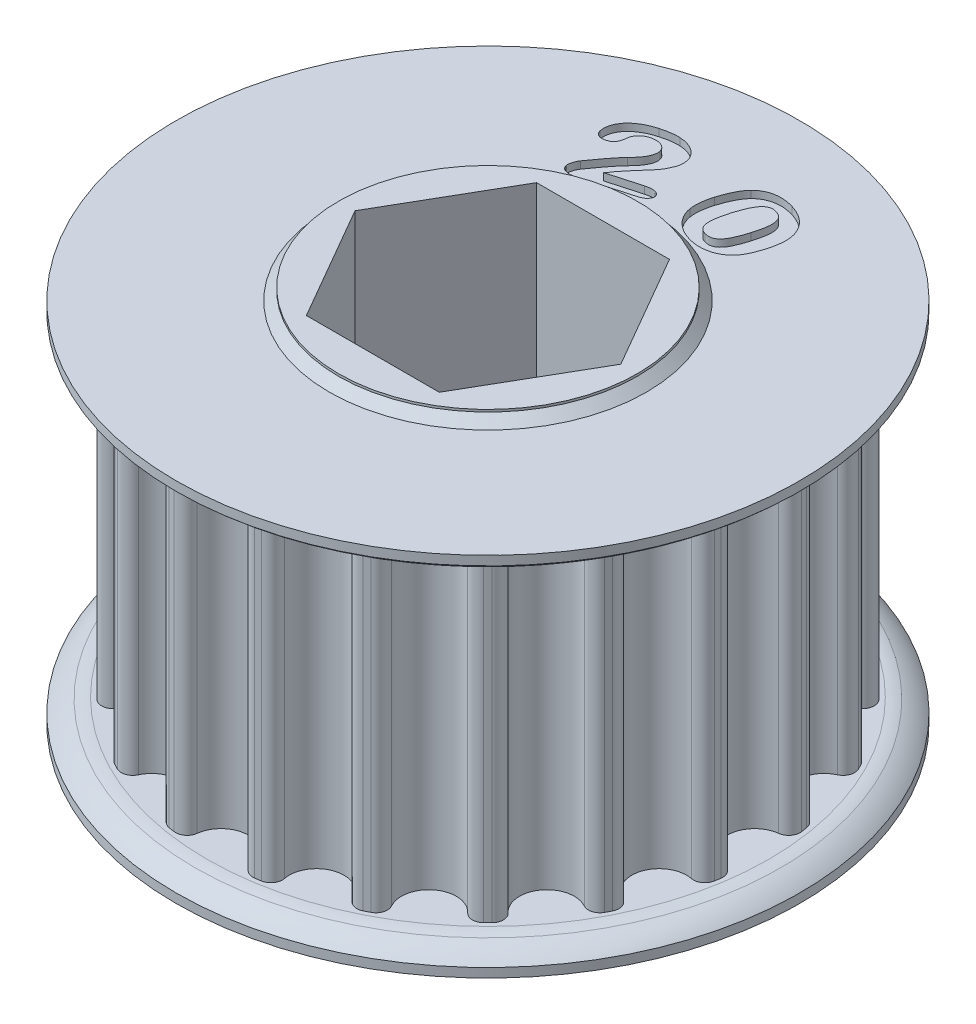
from build123d import *

# Parameters (mm, degrees)
SKETCH1_R               = 15.34399401
TOOTHOD_DEPTH           = 8.89
TOOTHPROFILE_DEPTH      = 29.053604124
TOOTHPATTERN_COUNT      = 20
SKETCH6_W               = 8.2931
SKETCH6_H               = 0.635
BORE_DEPTH              = 27.757745097
BORE_DEPTH_BACK         = 27.757745097
LARGE_TOOTH_COUNT_DEPTH = 0.4
CHAMFER1_SIZE           = 0.508


with BuildPart() as part:
    # Sketch1 → ToothOD (new, symmetric)
    with BuildSketch(Plane(origin=(0, 0, 0), x_dir=(1, 0, 0), z_dir=(0, 1, 0))):
        Circle(SKETCH1_R)
    extrude(amount=TOOTHOD_DEPTH, both=True)

    # Sketch2 → ToothProfile (cut, through all)
    with BuildSketch(Plane(origin=(0, 8.89, 0), x_dir=(1, 0, 0), z_dir=(0, 1, 0))):
        with BuildLine():
            ThreePointArc((-1.514151189, 14.627414336), (0, 13.28399401), (1.514151189, 14.627414336))
            ThreePointArc((1.514151189, 14.627414336), (1.759047929, 15.056333772), (2.237219512, 15.180019797))
            ThreePointArc((2.237219512, 15.180019797), (0, 15.34399401), (-2.237219512, 15.180019797))
            ThreePointArc((-2.237219512, 15.180019797), (-1.759047929, 15.056333772), (-1.514151189, 14.627414336))
        make_face()
    toothprofile = extrude(amount=-TOOTHPROFILE_DEPTH, mode=Mode.SUBTRACT)

    # ToothPattern: ToothProfile ×20 about axis
    toothpattern_axis = Axis((0, 8.89, 0), (0, -1, 0))
    for i in range(1, TOOTHPATTERN_COUNT):
        add(toothprofile.rotate(toothpattern_axis, i * 360 / TOOTHPATTERN_COUNT), mode=Mode.SUBTRACT)

    # Sketch4 → Flange (revolve)
    with BuildSketch(Plane.XY):
        with BuildLine():
            Line((0, -8.89), (15.59799401, -8.89))
            ThreePointArc((15.59799401, -8.89), (15.92375, -8.915622571), (16.243566338, -8.982637424))
            ThreePointArc((16.243566338, -8.982637424), (16.811294915, -9.264197125), (17.31249401, -9.652))
            Line((17.31249401, -9.652), (17.31249401, -10.16))
            Line((17.31249401, -10.16), (0, -10.16))
            Line((0, -10.16), (0, -8.89))
        make_face()
        with BuildLine():
            Line((17.31249401, 10.16), (17.31249401, 9.652))
            ThreePointArc((17.31249401, 9.652), (16.811294915, 9.264197125), (16.243566338, 8.982637424))
            ThreePointArc((16.243566338, 8.982637424), (15.92375, 8.915622571), (15.59799401, 8.89))
            Line((15.59799401, 8.89), (0, 8.89))
            Line((0, 8.89), (0, 10.16))
            Line((0, 10.16), (17.31249401, 10.16))
        make_face()
    revolve(axis=Axis((0, 12.09802, 0), (0, -1, 0)))

    # Sketch6 → TopBearingBoss (revolve)
    with BuildSketch(Plane.XY):
        with Locations((4.14655, 10.4775)):
            Rectangle(SKETCH6_W, SKETCH6_H)
    revolve(axis=Axis((0, 12.09802, 0), (0, -1, 0)))

    # Sketch7 → Bore (cut, two sides: drawn at the far end of the back side and taken through both)
    with BuildSketch(Plane.XZ.offset(-BORE_DEPTH_BACK)):
        Polygon((3.688171255, 6.3881), (-3.688171255, 6.3881), (-7.376342509, 0), (-3.688171255, -6.3881), (3.688171255, -6.3881), (7.376342509, 0), align=None)
    extrude(amount=BORE_DEPTH + BORE_DEPTH_BACK, mode=Mode.SUBTRACT)

    # Sketch9 → Large Tooth Count (cut)
    # profile 1 of 2: a face of its own
    with BuildSketch(Plane(origin=(0, 10.16, 0), x_dir=(1, 0, 0), z_dir=(0, 1, 0))):
        with BuildLine():
            Line((-2.954146893, 9.361462675), (-1.175353143, 9.862418144))
            add(Edge.make_bspline(
                [(-1.175353143, 9.862418144), (-1.123805554, 9.875802418), (-1.026048459, 9.901184938), (-0.883304523, 9.919166454), (-0.754108312, 9.920384436), (-0.63935479, 9.903206029), (-0.541555305, 9.870084112), (-0.462297286, 9.823371078), (-0.402653568, 9.761037925), (-0.383751751, 9.709454292), (-0.374360174, 9.683824394)],
                knots=[0, 0, 0, 0, 1.416600478, 2.686502891, 3.819686855, 4.846312523, 5.7610532, 6.550671378, 7.279885059, 8, 8, 8, 8], degree=3))
            add(Edge.make_bspline(
                [(-0.374360174, 9.683824394), (-0.369719108, 9.660087819), (-0.360266106, 9.611740771), (-0.371972129, 9.535402151), (-0.403229262, 9.458544917), (-0.453267189, 9.380882786), (-0.526096867, 9.307089619), (-0.62160342, 9.241903313), (-0.739824812, 9.186663473), (-0.827592685, 9.159151), (-0.874422674, 9.144471269)],
                knots=[0, 0, 0, 0, 0.710365878, 1.446884956, 2.24079361, 3.150954831, 4.15871712, 5.283676882, 6.550661213, 8, 8, 8, 8], degree=3))
            Line((-0.874422674, 9.144471269), (-3.564937518, 8.387233769))
            add(Edge.make_bspline(
                [(-3.564937518, 8.387233769), (-3.61171521, 8.37543609), (-3.700837127, 8.352958886), (-3.832442975, 8.342282282), (-3.953746135, 8.349940914), (-4.062486177, 8.379695319), (-4.157127763, 8.424314562), (-4.233382296, 8.48426447), (-4.291165156, 8.557997927), (-4.311755017, 8.615372811), (-4.322175018, 8.644408769)],
                knots=[0, 0, 0, 0, 1.301754116, 2.480131396, 3.552996869, 4.569626462, 5.508600737, 6.361601131, 7.170848347, 8, 8, 8, 8], degree=3))
            add(Edge.make_bspline(
                [(-4.322175018, 8.644408769), (-4.326580812, 8.665164293), (-4.336073853, 8.709885638), (-4.332624611, 8.784411615), (-4.322455052, 8.869128107), (-4.299543845, 8.961161902), (-4.27034487, 9.054523865), (-4.235617728, 9.143365747), (-4.1961476, 9.224365129), (-4.163762464, 9.272780303), (-4.148046112, 9.296275956)],
                knots=[0, 0, 0, 0, 0.735191842, 1.58409722, 2.57532651, 3.702715511, 4.874795235, 5.976270416, 7.017893645, 8, 8, 8, 8], degree=3))
            add(Edge.make_bspline(
                [(-4.148046112, 9.296275956), (-4.087211058, 9.382429832), (-3.969092279, 9.549708234), (-3.794337723, 9.790740454), (-3.627134069, 10.014150132), (-3.493100044, 10.188605296), (-3.391151145, 10.317214682), (-3.321382624, 10.403735091), (-3.257675155, 10.482773388), (-3.197071967, 10.55186435), (-3.144281079, 10.614722485), (-3.095438484, 10.668632161), (-3.052483765, 10.714698958), (-3.024770261, 10.742069301), (-3.012189862, 10.754493925)],
                knots=[0, 0, 0, 0, 2.052272746, 3.984741291, 5.793026345, 7.482136723, 8.265501849, 8.986445627, 9.645011633, 10.240581551, 10.774583818, 11.242129634, 11.655968724, 12, 12, 12, 12], degree=3))
            add(Edge.make_bspline(
                [(-3.012189862, 10.754493925), (-2.97279762, 10.794299168), (-2.896763622, 10.871130331), (-2.792806568, 10.988869332), (-2.701039663, 11.102694717), (-2.620574498, 11.212717556), (-2.553383732, 11.320286413), (-2.497592916, 11.424476859), (-2.454002898, 11.526306534), (-2.422746917, 11.625053273), (-2.402709489, 11.71988848), (-2.394004008, 11.810101015), (-2.397937406, 11.895345873), (-2.409888983, 11.949103964), (-2.415686737, 11.975182206)],
                knots=[0, 0, 0, 0, 1.423552018, 2.747707314, 3.991028065, 5.139956742, 6.210844286, 7.212885815, 8.141975106, 9.022746377, 9.842005735, 10.601823445, 11.321739559, 12, 12, 12, 12], degree=3))
            add(Edge.make_bspline(
                [(-2.415686737, 11.975182206), (-2.42429087, 12.001758675), (-2.441249197, 12.0541396), (-2.482578582, 12.125664714), (-2.535327991, 12.18909487), (-2.598872825, 12.244238856), (-2.671873029, 12.2906639), (-2.752660218, 12.328719573), (-2.842148698, 12.355153399), (-2.938047159, 12.37159083), (-3.038305704, 12.378979246), (-3.141121707, 12.374657925), (-3.245814936, 12.36229657), (-3.314774119, 12.344214881), (-3.349732049, 12.335048613)],
                knots=[0, 0, 0, 0, 0.90254133, 1.778864972, 2.655082592, 3.563625712, 4.491394034, 5.448683676, 6.445761391, 7.502723384, 8.594618504, 9.694102356, 10.831056182, 12, 12, 12, 12], degree=3))
            add(Edge.make_bspline(
                [(-3.349732049, 12.335048613), (-3.382418939, 12.324700344), (-3.446620887, 12.304374794), (-3.537125411, 12.263067652), (-3.620087769, 12.213267396), (-3.696565155, 12.156329349), (-3.765107736, 12.089722279), (-3.824340499, 12.013694183), (-3.879435722, 11.931578737), (-3.907718253, 11.87113381), (-3.922125018, 11.840343925)],
                knots=[0, 0, 0, 0, 1.049930399, 2.062220621, 3.039893766, 4.010392484, 4.977929152, 5.957982101, 6.959821796, 8, 8, 8, 8], degree=3))
            add(Edge.make_bspline(
                [(-3.922125018, 11.840343925), (-3.924346544, 11.832933466), (-3.931168204, 11.810178107), (-3.937056605, 11.762522536), (-3.950091222, 11.690823835), (-3.961933852, 11.598900745), (-3.979992527, 11.497578612), (-4.007626887, 11.398655278), (-4.042740729, 11.30637416), (-4.085519388, 11.220216479), (-4.144929258, 11.141703059), (-4.227777014, 11.077150199), (-4.330942518, 11.022005189), (-4.409730011, 10.997774061), (-4.451655487, 10.984879863)],
                knots=[0, 0, 0, 0, 0.255495149, 0.784551133, 1.582182714, 2.666380175, 3.847664823, 4.981851255, 6.056538028, 7.108499466, 8.153764709, 9.280368537, 10.552792622, 12, 12, 12, 12], degree=3))
            add(Edge.make_bspline(
                [(-4.451655487, 10.984879863), (-4.484518593, 10.977014405), (-4.548160913, 10.961782248), (-4.644496368, 10.956258535), (-4.73670461, 10.966954595), (-4.82346759, 10.993238394), (-4.901057808, 11.035922061), (-4.965744414, 11.095093645), (-5.016154224, 11.169717324), (-5.035502925, 11.227460955), (-5.045479705, 11.257235331)],
                knots=[0, 0, 0, 0, 1.104655038, 2.139262494, 3.14009217, 4.129518318, 5.089274639, 6.013546725, 6.975724119, 8, 8, 8, 8], degree=3))
            add(Edge.make_bspline(
                [(-5.045479705, 11.257235331), (-5.05397104, 11.293084372), (-5.071349422, 11.366453082), (-5.077754738, 11.481958813), (-5.072725552, 11.603249079), (-5.051844202, 11.729081667), (-5.016292017, 11.857336166), (-4.964770167, 11.985211731), (-4.897422878, 12.111016582), (-4.814660026, 12.23509846), (-4.715205717, 12.356092866), (-4.597286749, 12.47195975), (-4.46284857, 12.584034957), (-4.31031455, 12.689978389), (-4.14049305, 12.79094259), (-3.950695814, 12.87981994), (-3.743341884, 12.961365981), (-3.596866185, 13.004705712), (-3.521182049, 13.027099394)],
                knots=[0, 0, 0, 0, 0.684205447, 1.400296104, 2.14308195, 2.939673375, 3.767285031, 4.614614734, 5.499007285, 6.417452817, 7.385287256, 8.407291256, 9.488547988, 10.637669497, 11.859015001, 13.159415024, 14.532266988, 16, 16, 16, 16], degree=3))
            add(Edge.make_bspline(
                [(-3.521182049, 13.027099394), (-3.4736299, 13.03988753), (-3.380335158, 13.064977161), (-3.241544955, 13.097089226), (-3.107026771, 13.124112364), (-2.976265984, 13.14490228), (-2.8495897, 13.158917372), (-2.727192142, 13.168269746), (-2.608850533, 13.171070654), (-2.531470246, 13.16854091), (-2.493375018, 13.167295488)],
                knots=[0, 0, 0, 0, 1.134348345, 2.225530054, 3.281228752, 4.294749574, 5.274655805, 6.216612838, 7.122017479, 8, 8, 8, 8], degree=3))
            add(Edge.make_bspline(
                [(-2.493375018, 13.167295488), (-2.439709954, 13.16272022), (-2.334541326, 13.153753966), (-2.181332224, 13.127305431), (-2.036981563, 13.087440761), (-1.901006644, 13.037993111), (-1.775042238, 12.977076771), (-1.658865503, 12.907098719), (-1.552797444, 12.827923999), (-1.459758972, 12.738048259), (-1.376703421, 12.643511102), (-1.309975797, 12.541360057), (-1.254518112, 12.43604159), (-1.230849347, 12.361372234), (-1.219108612, 12.324332988)],
                knots=[0, 0, 0, 0, 1.190830805, 2.333697818, 3.432410255, 4.498757827, 5.529248872, 6.521607877, 7.494563189, 8.449082834, 9.378017597, 10.270819197, 11.142251172, 12, 12, 12, 12], degree=3))
            add(Edge.make_bspline(
                [(-1.219108612, 12.324332988), (-1.211383801, 12.294688493), (-1.195989155, 12.235610479), (-1.183332882, 12.145192252), (-1.176603551, 12.054774787), (-1.178486449, 11.963899215), (-1.188610174, 11.872881101), (-1.205430531, 11.781423706), (-1.230525716, 11.690002431), (-1.274849659, 11.570781829), (-1.33741533, 11.429640428), (-1.41591175, 11.271086939), (-1.50151055, 11.130952631), (-1.579521706, 11.024672795), (-1.647287016, 10.941396881), (-1.706925628, 10.872235184), (-1.772228142, 10.792201909), (-1.847731998, 10.704799598), (-1.931711291, 10.608913676), (-2.022333861, 10.502919779), (-2.123153923, 10.389883416), (-2.227945717, 10.269423426), (-2.334199707, 10.149850826), (-2.432223405, 10.033064938), (-2.522427016, 9.924904713), (-2.603216232, 9.823238211), (-2.675411176, 9.729477266), (-2.73794607, 9.642126083), (-2.79312732, 9.563443557), (-2.824329241, 9.511648282), (-2.838953924, 9.487371269)],
                knots=[0, 0, 0, 0, 0.759348993, 1.513293812, 2.260847921, 3.006759253, 3.764275153, 4.530379131, 5.311389733, 6.112558984, 7.683247224, 9.139506665, 10.498308862, 11.750708933, 12.406871982, 13.161322828, 14.015965315, 14.96902083, 16.02622199, 17.177907503, 18.428216246, 19.783402464, 21.138588682, 22.396006758, 23.565473171, 24.632146706, 25.617187237, 26.500440687, 27.297140101, 28, 28, 28, 28], degree=3))
            add(Edge.make_bspline(
                [(-2.838953924, 9.487371269), (-2.855289837, 9.463900755), (-2.888073876, 9.416798504), (-2.932072354, 9.379949994), (-2.954146893, 9.361462675)],
                knots=[0, 0, 0, 0, 0.996577163, 2, 2, 2, 2], degree=3))
        make_face()
    # profile 2 of 2: a face of its own
    with BuildSketch(Plane(origin=(0, 10.16, 0), x_dir=(1, 0, 0), z_dir=(0, 1, 0))):
        with BuildLine():
            add(Edge.make_bspline(
                [(5.214409045, 10.150130338), (5.190714867, 10.074880459), (5.1449507, 9.929538937), (5.067123561, 9.722992573), (4.985074358, 9.534662094), (4.897683151, 9.362490125), (4.797990216, 9.204699763), (4.68207819, 9.059315083), (4.548391417, 8.924355594), (4.448207144, 8.844811647), (4.397342639, 8.804426432)],
                knots=[0, 0, 0, 0, 1.18011728, 2.279339777, 3.300312696, 4.252335004, 5.165279864, 6.087474786, 7.028992811, 8, 8, 8, 8], degree=3))
            add(Edge.make_bspline(
                [(4.397342639, 8.804426432), (4.368452389, 8.783759012), (4.310444351, 8.742261398), (4.218090567, 8.68760354), (4.122567032, 8.636381907), (4.021053968, 8.594804769), (3.917071626, 8.55542857), (3.807864453, 8.524522636), (3.694856927, 8.498897601), (3.578149786, 8.477916033), (3.458784674, 8.465052918), (3.337809148, 8.457659325), (3.215789514, 8.457269131), (3.092816601, 8.466425015), (2.968336345, 8.478893397), (2.842901635, 8.500737733), (2.716334551, 8.529457806), (2.632441476, 8.553128463), (2.589973889, 8.565110807)],
                knots=[0, 0, 0, 0, 0.901536881, 1.810174201, 2.722951407, 3.650873295, 4.592999596, 5.545017892, 6.529601249, 7.5348545, 8.553963068, 9.576094043, 10.611551205, 11.649240286, 12.705913058, 13.786930103, 14.879719961, 16, 16, 16, 16], degree=3))
            add(Edge.make_bspline(
                [(2.589973889, 8.565110807), (2.543632445, 8.579700214), (2.452042396, 8.608534977), (2.319678008, 8.661606647), (2.193694452, 8.721556974), (2.07328836, 8.787716416), (1.959122861, 8.861323411), (1.84975651, 8.940228266), (1.747631416, 9.027720056), (1.651608943, 9.121077228), (1.562444683, 9.219388851), (1.482907007, 9.322900319), (1.410803045, 9.429205404), (1.348352462, 9.54012966), (1.294619283, 9.655154495), (1.248761777, 9.773672505), (1.213020235, 9.896616587), (1.195786369, 9.980335913), (1.187119983, 10.022435807)],
                knots=[0, 0, 0, 0, 1.093974974, 2.162151445, 3.208754958, 4.235018977, 5.254163096, 6.266603484, 7.270125483, 8.279987647, 9.281626696, 10.256545703, 11.217884655, 12.172537706, 13.120291723, 14.075274297, 15.032114198, 16, 16, 16, 16], degree=3))
            add(Edge.make_bspline(
                [(1.187119983, 10.022435807), (1.180867164, 10.069996862), (1.168240345, 10.166040708), (1.1601745, 10.312869392), (1.163621366, 10.463459377), (1.174789304, 10.6179706), (1.197160825, 10.776345136), (1.22609065, 10.938288092), (1.264806684, 11.103647427), (1.296751927, 11.213792398), (1.313028577, 11.26991315)],
                knots=[0, 0, 0, 0, 0.910485463, 1.838616153, 2.788107085, 3.768457025, 4.77780678, 5.823027201, 6.890795017, 8, 8, 8, 8], degree=3))
            add(Edge.make_bspline(
                [(1.313028577, 11.26991315), (1.33538935, 11.341535758), (1.379078841, 11.481475247), (1.452154195, 11.682542865), (1.529127683, 11.87032368), (1.609998022, 12.044290335), (1.6952769, 12.205137541), (1.787378592, 12.350429447), (1.883615047, 12.482465752), (1.954403412, 12.561103972), (1.98900592, 12.599543619)],
                knots=[0, 0, 0, 0, 1.196779593, 2.338322093, 3.411423727, 4.433178792, 5.397622731, 6.313149774, 7.175440056, 8, 8, 8, 8], degree=3))
            add(Edge.make_bspline(
                [(1.98900592, 12.599543619), (2.018628391, 12.628603845), (2.077103584, 12.685969161), (2.171791495, 12.762895464), (2.270271079, 12.832357217), (2.373785475, 12.892330016), (2.480624357, 12.946184702), (2.592696711, 12.989493011), (2.708793143, 13.025239338), (2.829056329, 13.052964555), (2.952560802, 13.072627552), (3.079412612, 13.083143097), (3.208835866, 13.085694737), (3.341290865, 13.080548732), (3.476299628, 13.065774952), (3.61437117, 13.043471927), (3.75507657, 13.012338384), (3.848891552, 12.985499356), (3.89638717, 12.971911588)],
                knots=[0, 0, 0, 0, 0.971271056, 1.917303395, 2.853215794, 3.790451001, 4.716264034, 5.652098562, 6.6001573, 7.558841376, 8.539768638, 9.526129073, 10.537034007, 11.569480832, 12.627883147, 13.715356414, 14.843355738, 16, 16, 16, 16], degree=3))
            add(Edge.make_bspline(
                [(3.89638717, 12.971911588), (3.961047138, 12.951501287), (4.087573261, 12.911562568), (4.26784755, 12.835416509), (4.436188729, 12.750440953), (4.590932452, 12.653297499), (4.733128735, 12.548330058), (4.861794309, 12.434592971), (4.975915242, 12.311534463), (5.075655196, 12.180079229), (5.162485109, 12.042696768), (5.235003627, 11.900099386), (5.294184558, 11.753211843), (5.321379679, 11.651830378), (5.334959827, 11.601204557)],
                knots=[0, 0, 0, 0, 1.170483588, 2.290393202, 3.375582303, 4.424020791, 5.441917151, 6.425119279, 7.385477153, 8.335528901, 9.2711732, 10.18851884, 11.095419263, 12, 12, 12, 12], degree=3))
            add(Edge.make_bspline(
                [(5.334959827, 11.601204557), (5.345438057, 11.551051125), (5.366875769, 11.448440786), (5.381402987, 11.288093713), (5.386496657, 11.119523422), (5.37668279, 10.94229087), (5.355085027, 10.756243659), (5.320633311, 10.561374709), (5.274470628, 10.357721475), (5.234765054, 10.220486907), (5.214409045, 10.150130338)],
                knots=[0, 0, 0, 0, 0.834578345, 1.707487665, 2.620008346, 3.581952147, 4.597888727, 5.671599988, 6.806290297, 8, 8, 8, 8], degree=3))
        make_face()
        with BuildLine():
            add(Edge.make_bspline(
                [(4.031225452, 10.56982565), (4.04357031, 10.611754452), (4.067764283, 10.693928279), (4.100757692, 10.814739321), (4.129381589, 10.930615781), (4.154607751, 11.040966004), (4.17517115, 11.146384723), (4.191469661, 11.246428339), (4.20286392, 11.341205651), (4.213841097, 11.457443534), (4.216752136, 11.592054856), (4.202110036, 11.740591906), (4.171074433, 11.872605872), (4.127424694, 11.969388232), (4.083881673, 12.037912926), (4.045434796, 12.084373108), (4.000776302, 12.126406709), (3.951930174, 12.1663729), (3.895704752, 12.200546592), (3.835309816, 12.2331379), (3.768732382, 12.260690902), (3.722073138, 12.275724197), (3.698148108, 12.283432682)],
                knots=[0, 0, 0, 0, 1.326170746, 2.599085169, 3.799445801, 4.94753492, 6.033295135, 7.057791564, 8.022292309, 8.929082325, 10.600110398, 12.098179301, 13.447489324, 14.696469786, 15.297719383, 15.907121204, 16.520325778, 17.15644649, 17.817961626, 18.512851169, 19.237448412, 20, 20, 20, 20], degree=3))
            add(Edge.make_bspline(
                [(3.698148108, 12.283432682), (3.667653286, 12.291427612), (3.608467335, 12.306944593), (3.518859453, 12.315603473), (3.43228089, 12.313007472), (3.348970179, 12.294162773), (3.268843326, 12.263717987), (3.191916068, 12.219918135), (3.118272519, 12.163156193), (3.048551775, 12.092068958), (2.979738045, 12.008223912), (2.914539397, 11.907932136), (2.848206908, 11.793856803), (2.784246551, 11.663475333), (2.721164908, 11.517923561), (2.658918626, 11.35696549), (2.597074002, 11.180720122), (2.558899013, 11.057224397), (2.53907467, 10.993092838)],
                knots=[0, 0, 0, 0, 0.779608217, 1.513104545, 2.221386719, 2.915408799, 3.617719978, 4.337304937, 5.09957383, 5.912718864, 6.798071582, 7.781475227, 8.871367297, 10.064760717, 11.37536222, 12.799043681, 14.337737445, 16, 16, 16, 16], degree=3))
            add(Edge.make_bspline(
                [(2.53907467, 10.993092838), (2.525780531, 10.948798919), (2.499803053, 10.862246169), (2.465057265, 10.73449515), (2.434565149, 10.612447484), (2.409051423, 10.496192633), (2.385689628, 10.386027538), (2.369510135, 10.280960181), (2.355595424, 10.18190809), (2.343868918, 10.061130514), (2.339639419, 9.922828249), (2.350968028, 9.771566451), (2.3796989, 9.639943096), (2.426133084, 9.526879767), (2.492105714, 9.432454634), (2.5754877, 9.355240728), (2.675763288, 9.292853541), (2.751545994, 9.266420565), (2.790891858, 9.252696744)],
                knots=[0, 0, 0, 0, 1.129632941, 2.207364826, 3.233713364, 4.202180195, 5.114802594, 5.983834708, 6.798254548, 7.557928904, 8.947170659, 10.172937136, 11.254195191, 12.225169878, 13.138921205, 14.044331844, 14.984630429, 16, 16, 16, 16], degree=3))
            add(Edge.make_bspline(
                [(2.790891858, 9.252696744), (2.81520806, 9.24606045), (2.862572058, 9.233134031), (2.933678635, 9.220591584), (3.00207604, 9.214307045), (3.068211057, 9.213853312), (3.131658175, 9.221202469), (3.192706609, 9.234608636), (3.251390292, 9.254092676), (3.326480383, 9.29123363), (3.417640784, 9.352659395), (3.517714155, 9.450500325), (3.613187275, 9.570539223), (3.684054974, 9.688732373), (3.739933925, 9.794808606), (3.782672042, 9.883814369), (3.824376633, 9.980554467), (3.866377238, 10.084159167), (3.908185032, 10.194975421), (3.950511202, 10.312951239), (3.99116818, 10.438835364), (4.017651783, 10.525438733), (4.031225452, 10.56982565)],
                knots=[0, 0, 0, 0, 0.740928597, 1.443208135, 2.119986108, 2.75897178, 3.38438367, 3.99391264, 4.594578025, 5.197471523, 6.452606339, 7.808452879, 9.297145185, 10.951528506, 11.852090658, 12.823028486, 13.854016112, 14.949569282, 16.110321297, 17.336804467, 18.635029525, 20, 20, 20, 20], degree=3))
        make_face(mode=Mode.SUBTRACT)
    extrude(amount=-LARGE_TOOTH_COUNT_DEPTH, mode=Mode.SUBTRACT)

    # Chamfer1
    chamfer1_edges = [part.edges().sort_by_distance(p)[0] for p in [
        (-8.2931, 10.16, 0),
    ]]
    chamfer(chamfer1_edges, length=CHAMFER1_SIZE)


solid = part.part
